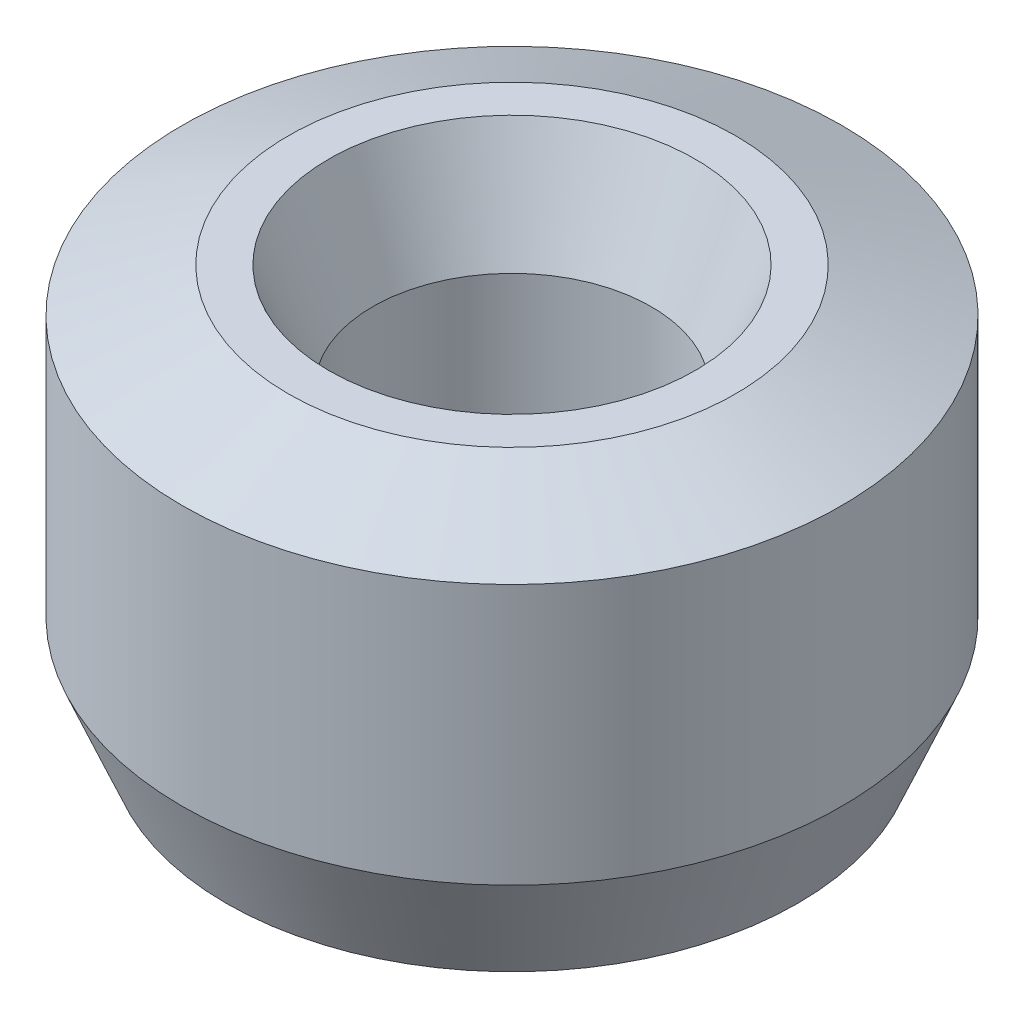
from build123d import *
from OCP.BRepFilletAPI import BRepFilletAPI_MakeChamfer

# Parameters (mm, degrees)
SKETCH1_R           = 25
BOSS_EXTRUDE1_DEPTH = 31.119095223
SKETCH2_R           = 10.572424461
CUT_EXTRUDE1_DEPTH  = 48.09987354
CHAMFER1_SIZE       = 3.326934427
CHAMFER1_SIZE2      = 8.036076931


with BuildPart() as part:
    # Sketch1 → Boss-Extrude1 (new body)
    with BuildSketch(Plane(origin=(0, 0, 0), x_dir=(1, 0, 0), z_dir=(0, 1, 0))):
        Circle(SKETCH1_R)
    extrude(amount=BOSS_EXTRUDE1_DEPTH)

    # Sketch2 → Cut-Extrude1 (cut, through all)
    with BuildSketch(Plane(origin=(0, 0, 0), x_dir=(1, 0, 0), z_dir=(0, 1, 0))):
        Circle(SKETCH2_R)
    extrude(amount=CUT_EXTRUDE1_DEPTH, mode=Mode.SUBTRACT)

    # Chamfer1: one chamfer whose edges measure the first distance from different faces: ONE call of the kernel's chamfer builder (chamfer() names one face for all edges)
    chamfer1_edges_1 = [part.edges().sort_by_distance(p)[0] for p in [
        (-10.572424461, 31.119095223, 0),
    ]]
    chamfer1_side_1 = [part.faces().sort_by_distance(p)[0] for p in [
        (-24.292893219, 31.119095223, 0),
    ]]
    chamfer1_edges_2 = [part.edges().sort_by_distance(p)[0] for p in [
        (-10.572424461, 0, 0),
    ]]
    chamfer1_side_2 = [part.faces().sort_by_distance(p)[0] for p in [
        (-10.572424461, 15.559547612, 0),
    ]]
    chamfer1_edges_3 = [part.edges().sort_by_distance(p)[0] for p in [
        (-25, 0, 0),
    ]]
    chamfer1_side_3 = [part.faces().sort_by_distance(p)[0] for p in [
        (-24.292893219, 0, 0),
    ]]
    chamfer1_edges_4 = [part.edges().sort_by_distance(p)[0] for p in [
        (-25, 31.119095223, 0),
    ]]
    chamfer1_side_4 = [part.faces().sort_by_distance(p)[0] for p in [
        (-25, 15.559547612, 0),
    ]]
    chamfer1 = BRepFilletAPI_MakeChamfer(part.part.solid().wrapped)
    for e in chamfer1_edges_1:
        chamfer1.Add(CHAMFER1_SIZE, CHAMFER1_SIZE2, e.wrapped, chamfer1_side_1[0].wrapped)  # the first distance lies on this face
    for e in chamfer1_edges_2:
        chamfer1.Add(CHAMFER1_SIZE, CHAMFER1_SIZE2, e.wrapped, chamfer1_side_2[0].wrapped)  # the first distance lies on this face
    for e in chamfer1_edges_3:
        chamfer1.Add(CHAMFER1_SIZE, CHAMFER1_SIZE2, e.wrapped, chamfer1_side_3[0].wrapped)  # the first distance lies on this face
    for e in chamfer1_edges_4:
        chamfer1.Add(CHAMFER1_SIZE, CHAMFER1_SIZE2, e.wrapped, chamfer1_side_4[0].wrapped)  # the first distance lies on this face
    add(Compound.cast(chamfer1.Shape()), mode=Mode.REPLACE)


solid = part.part
